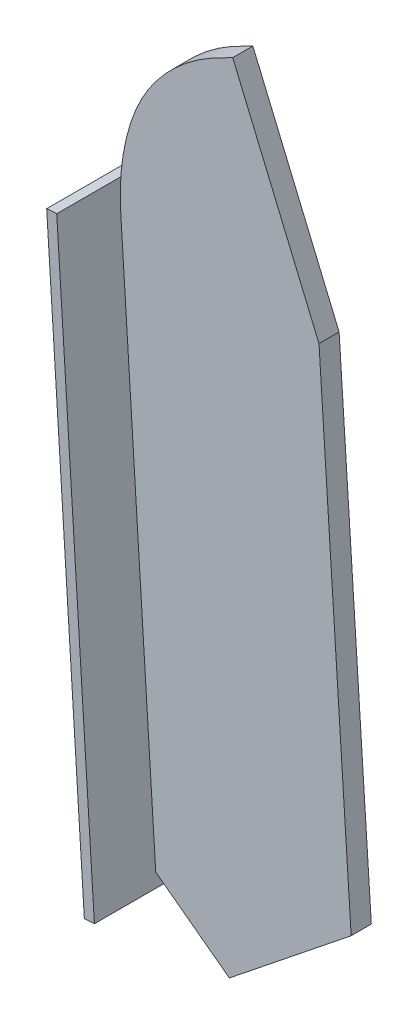
from build123d import *

# Parameters (mm, degrees)
EXTRUDE_1_DEPTH     = 1.2
CUT_EXTRUDE_START   = -1.2
CUT_EXTRUDE_1_DEPTH = 1.2
SKETCH_4_R          = 0.3
EXTRUDE_2_DEPTH     = 0.3
SKETCH_5_W          = 8.574992792
SKETCH_5_H          = 35.59001433
EXTRUDE_3_DEPTH     = 0.6


# Read off the part's stored shape, not the designer's step: Вырез-Вытянуть-Тонкостенный1
with BuildPart() as part:
    # Эскиз1 → Бобышка-Вытянуть1 (new body)
    with BuildSketch(Plane.XY):
        with BuildLine():
            Line((-5.154205728, -20.72997941), (-0.373828409, -24.299606142))
            Line((-0.373828409, -24.299606142), (7.292363911, -18.166652286))
            Line((7.292363911, -18.166652286), (5.355661958, 11.708005491))
            Line((5.355661958, 11.708005491), (0.043580434, 24.299606142))
            Line((0.043580434, 24.299606142), (-0.335864947, 24.169962303))
            add(Edge.make_bspline(
                [(-0.335864947, 24.169962303), (-0.915680869, 23.882560356), (-2.036028517, 23.32722877), (-3.511970223, 22.237099766), (-4.75482851, 21.003209681), (-5.762815681, 19.609778776), (-6.510522146, 18.041460832), (-7.00511156, 16.321943976), (-7.292363911, 14.445670921), (-7.266146832, 13.148358332), (-7.252515423, 12.473828633)],
                knots=[0, 0, 0, 0, 0.133243547, 0.257459461, 0.376453369, 0.49320762, 0.610289886, 0.732843248, 0.86109349, 1, 1, 1, 1], degree=3))
            Line((-7.252515423, 12.473828633), (-5.154205728, -20.72997941))
        make_face()
    extrude(amount=EXTRUDE_1_DEPTH)

    # Вырез-Вытянуть-Тонкостенный1 outline → Вырез-Вытянуть-Тонкостенный1 (cut)
    with BuildSketch(Plane.XY.offset(1.2).offset(CUT_EXTRUDE_START)):
        with BuildLine():
            Line((0.043580434, 24.299606142), (-0.335864947, 24.169962303))
            add(Edge.make_bspline(
                [(-0.335864947, 24.169962303), (-0.915680869, 23.882560356), (-2.036028517, 23.32722877), (-3.511970223, 22.237099766), (-4.75482851, 21.003209681), (-5.762815681, 19.609778776), (-6.510522146, 18.041460832), (-7.00511156, 16.321943976), (-7.292363911, 14.445670921), (-7.266146832, 13.148358332), (-7.252515423, 12.473828633)],
                knots=[0, 0, 0, 0, 0.133243547, 0.257459461, 0.376453369, 0.49320762, 0.610289886, 0.732843248, 0.86109349, 1, 1, 1, 1], degree=3))
            Line((-7.252515423, 12.473828633), (-5.154205728, -20.72997941))
            Line((-5.154205728, -20.72997941), (-0.373828409, -24.299606142))
            Line((-0.373828409, -24.299606142), (7.292363911, -18.166652286))
            Line((7.292363911, -18.166652286), (5.355661958, 11.708005491))
            Line((5.355661958, 11.708005491), (0.043580434, 24.299606142))
        make_face()
        with BuildLine():
            add(Edge.make_bspline(
                [(-0.181718189, 23.79992617), (-0.707013415, 23.539538063), (-1.232077833, 23.278807084), (-2.230510803, 22.680549291), (-2.702172016, 22.340486172), (-3.596295179, 21.58727288), (-4.022133554, 21.170752521), (-4.785274575, 20.282262055), (-5.126061609, 19.808572418), (-5.567321736, 19.047557585), (-5.703329339, 18.784315196), (-5.950182465, 18.247397148), (-6.060575566, 17.974952319), (-6.35630443, 17.146776614), (-6.507229216, 16.580522405), (-6.739435456, 15.426716133), (-6.817026677, 14.83956809), (-6.876685102, 13.667024978), (-6.864657606, 13.078754602), (-6.852770472, 12.490490929)],
                knots=[0, 0, 0, 0, 0.125, 0.125, 0.25, 0.25, 0.375, 0.375, 0.5, 0.5, 0.5625, 0.5625, 0.625, 0.625, 0.75, 0.75, 0.875, 0.875, 1, 1, 1, 1], degree=3))
            Line((-0.181718189, 23.79992617), (-0.180003158, 23.800512138))
            Line((-0.180003158, 23.800512138), (4.960868317, 11.614742715))
            Line((4.960868317, 11.614742715), (6.879717061, -17.984519827))
            Line((6.879717061, -17.984519827), (-0.382255806, -23.794098121))
            Line((-0.382255806, -23.794098121), (-4.766668047, -20.520148369))
            Line((-4.766668047, -20.520148369), (-6.852770472, 12.490490929))
        make_face(mode=Mode.SUBTRACT)
    extrude(amount=CUT_EXTRUDE_1_DEPTH, mode=Mode.SUBTRACT)

    # Эскиз4 → Бобышка-Вытянуть2 (add)
    with BuildSketch(Plane(origin=(-6.03931721, -0.38165375, 0), x_dir=(0, 0, 1), z_dir=(-0.9980091663650418, -0.06306904035542692, 0))):
        with Locations(Location((0.6, -19.578666988, 0), (0, 0, 270))):
            Circle(SKETCH_4_R)
        with Locations(Location((0.6, -8.978666988, 0), (0, 0, 270))):
            Circle(SKETCH_4_R)
        with Locations(Location((0.6, 1.621333012, 0), (0, 0, 270))):
            Circle(SKETCH_4_R)
        with Locations(Location((0.6, 12.221333012, 0), (0, 0, 270))):
            Circle(SKETCH_4_R)
    extrude(amount=EXTRUDE_2_DEPTH)

    # Эскиз5 → Бобышка-Вытянуть3 (add)
    with BuildSketch(Plane(origin=(-6.33871996, -0.400574462, 0), x_dir=(0, 0, 1), z_dir=(-0.9980091663650418, -0.06306904035542692, 0))):
        with Locations((0.334402878, -3.441718967)):
            Rectangle(SKETCH_5_W, SKETCH_5_H)
    extrude(amount=EXTRUDE_3_DEPTH)


solid = part.part
